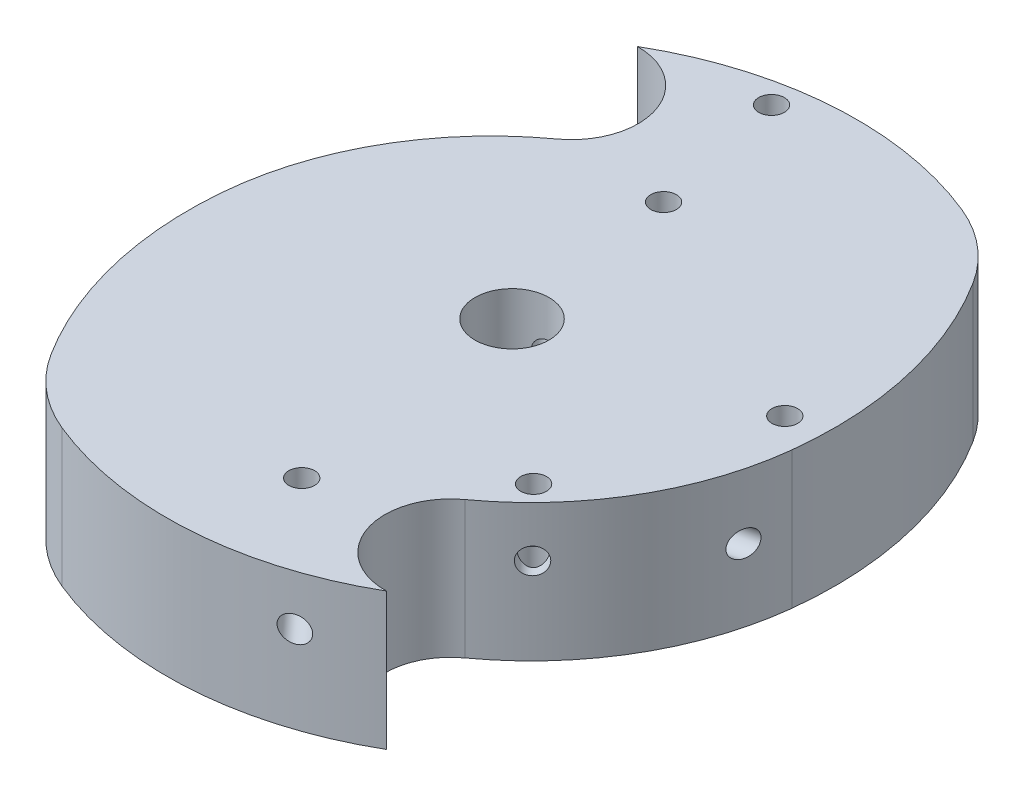
from build123d import *

# Parameters (mm, degrees)
BOSS_EXTRUDE1_DEPTH    = 32
SCALE1_SCALE_X         = 1.15
SCALE1_SCALE_Y         = 1
SCALE1_SCALE_Z         = 1.15
F_6_0MM_DOWEL_HOLE1_D  = 6
F_6_0MM_DOWEL_HOLE2_D  = 6
F_6_0MM_DOWEL_HOLE4_D  = 6
F_6_0MM_DOWEL_HOLE5_D  = 6
F_6_0MM_DOWEL_HOLE6_D  = 6
F_6_0MM_DOWEL_HOLE9_D  = 6
F_6_0MM_DOWEL_HOLE10_D = 6
F_6_0MM_DOWEL_HOLE11_D = 6


with BuildPart() as part:
    # Sketch1 → Boss-Extrude1 (new body)
    with BuildSketch(Plane(origin=(0, 0, 0), x_dir=(1, 0, 0), z_dir=(0, 1, 0))):
        with BuildLine():
            ThreePointArc((-40.468732368, -53.043555068), (-34.374294453, -60.013109178), (-26.444953998, -64.7924834))
            ThreePointArc((-26.444953998, -64.7924834), (4.820789434, -69.815195239), (35.099445331, -60.54279837))
            ThreePointArc((35.099445331, -60.54279837), (22.192557912, -51.515302537), (26.985036185, -36.511450503))
            ThreePointArc((26.985036185, -36.511450503), (43.610550753, -18.162163796), (51.41087908, 5.338026317))
            ThreePointArc((51.41087908, 5.338026317), (50.011192118, 30.12463858), (40.468732368, 53.043555068))
            ThreePointArc((40.468732368, 53.043555068), (34.374294453, 60.013109178), (26.444953998, 64.7924834))
            ThreePointArc((26.444953998, 64.7924834), (-4.820789434, 69.815195239), (-35.099445331, 60.54279837))
            ThreePointArc((-35.099445331, 60.54279837), (-22.143555727, 51.282350824), (-27.037571097, 36.127827482))
            ThreePointArc((-27.037571097, 36.127827482), (-44.058306069, 17.074808002), (-51.609096582, -7.33233302))
            ThreePointArc((-51.609096582, -7.33233302), (-49.780533598, -31.099820776), (-40.468732368, -53.043555068))
        make_face()
        with BuildLine():
            ThreePointArc((-3.761652404, 6.488449059), (-3.755827715, 6.491822408), (-3.75, 6.495190528))
            ThreePointArc((-3.75, 6.495190528), (3.75, 6.495190528), (7.5, 0))
            ThreePointArc((7.5, 0), (6.498553417, -3.744169265), (3.761652404, -6.488449059))
            ThreePointArc((3.761652404, -6.488449059), (-6.488449059, -3.761652404), (-3.761652404, 6.488449059))
        make_face(mode=Mode.SUBTRACT)
    extrude(amount=BOSS_EXTRUDE1_DEPTH)


with BuildPart() as part_1:
    # Scale1: scaled about (0.029342222, 16, 0.019287338)
    add(part.part.scale((SCALE1_SCALE_X, SCALE1_SCALE_Y, SCALE1_SCALE_Z), about=(0.029342222, 16, 0.019287338)))

    # Ø6.0mm Dowel Hole1 (through all)
    with Locations(Plane(origin=(150.552605171, -30.766452414, -103.65766124), x_dir=(0.9769227078158271, -1.3360659569752223e-15, -0.2135931247811878), z_dir=(0, -1, 0))):
        with Locations((-166.162017209, -5.414641336)):
            Hole(F_6_0MM_DOWEL_HOLE1_D / 2)

    # Ø6.0mm Dowel Hole2 (through all)
    with Locations(Plane(origin=(150.552605171, -30.766452414, -103.65766124), x_dir=(0.9769227078158271, -1.3360659569752223e-15, -0.2135931247811878), z_dir=(0, -1, 0))):
        with Locations((-166.175485163, 27.545698678)):
            Hole(F_6_0MM_DOWEL_HOLE2_D / 2)

    # Ø6.0mm Dowel Hole4 (through all)
    with Locations(Plane(origin=(150.552605171, -30.766452414, -103.65766124), x_dir=(0.9769227078158271, -1.3360659569752223e-15, -0.2135931247811878), z_dir=(0, -1, 0))):
        with Locations((-116.36131448, 68.191325462)):
            Hole(F_6_0MM_DOWEL_HOLE4_D / 2)

    # Ø6.0mm Dowel Hole5 (through all)
    with Locations(Plane(origin=(86.699652843, 143.313001555, -89.69693384), x_dir=(0, 1, 0), z_dir=(0.9769227078158271, -1.53114431115783e-15, -0.21359312478118775))):
        with Locations((-126.399729662, 84.576636181)):
            Hole(F_6_0MM_DOWEL_HOLE5_D / 2)

    # Ø6.0mm Dowel Hole6 (through all)
    with Locations(Plane(origin=(150.552605171, -30.766452414, -103.65766124), x_dir=(0.9769227078158271, -1.3360659569752223e-15, -0.2135931247811878), z_dir=(0, -1, 0))):
        with Locations((-173.858224897, 126.122531585)):
            Hole(F_6_0MM_DOWEL_HOLE6_D / 2)

    # Ø6.0mm Dowel Hole9 (through all)
    with Locations(Plane(origin=(150.552605171, -30.766452414, -103.65766124), x_dir=(0.9769227078158271, -1.3360659569752223e-15, -0.2135931247811878), z_dir=(0, -1, 0))):
        with Locations((-140.764255961, 106.890061518)):
            Hole(F_6_0MM_DOWEL_HOLE9_D / 2)

    # Ø6.0mm Dowel Hole10 (through all)
    with Locations(Plane(origin=(200.779213761, 143.313001555, -48.544651726), x_dir=(0, -1, 0), z_dir=(0.6735818327070141, -5.357499178770784e-15, 0.7391126535563168))):
        with Locations((123.097877986, -175.280990501)):
            Hole(F_6_0MM_DOWEL_HOLE10_D / 2)

    # Ø6.0mm Dowel Hole11 (through all)
    with Locations(Plane(origin=(200.779213761, 143.313001555, -48.544651726), x_dir=(0, -1, 0), z_dir=(0.6735818327070141, -5.357499178770784e-15, 0.7391126535563168))):
        with Locations((123.026211567, -213.535463753)):
            Hole(F_6_0MM_DOWEL_HOLE11_D / 2)


solid = part_1.part
